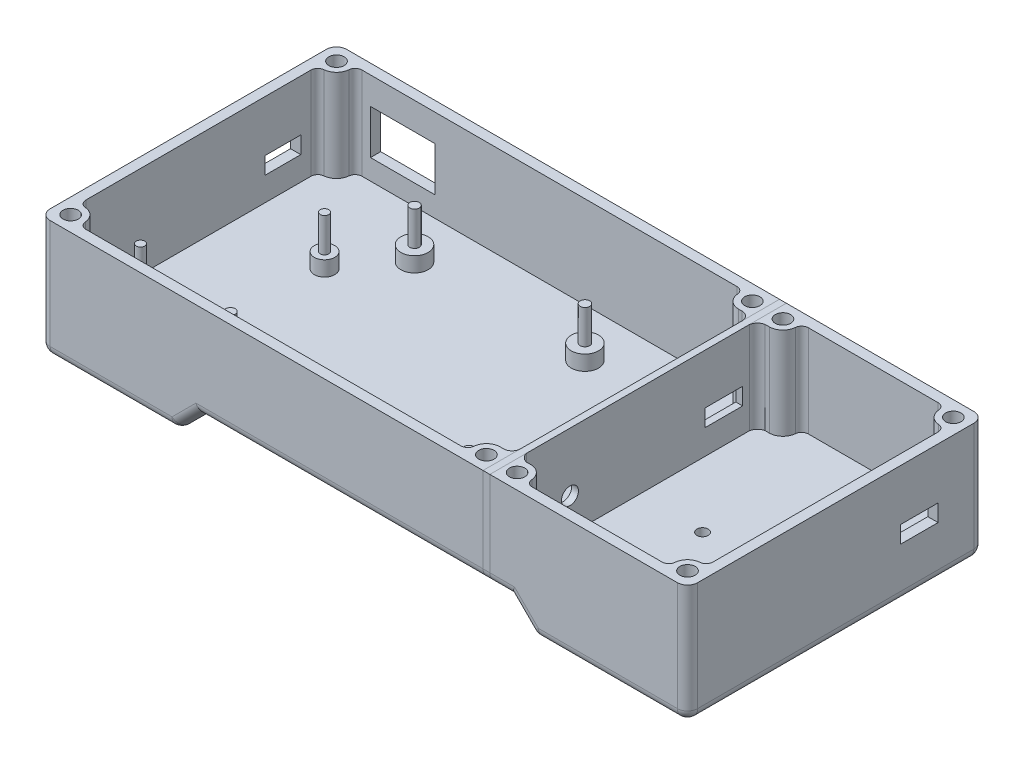
from build123d import *

# Parameters (mm, degrees)
SKETCH1_W           = 128
SKETCH1_H           = 87
BOSS_EXTRUDE1_DEPTH = 17.5
SKETCH1_4_W         = 48
SKETCH1_4_H         = 87
BOSS_EXTRUDE3_DEPTH = 17.5
SKETCH1_5_W         = 2
SKETCH1_5_H         = 87
BOSS_EXTRUDE4_DEPTH = 17.5
CUT_EXTRUDE1_DEPTH  = 27
FILLET1_R           = 2
CUT_EXTRUDE2_DEPTH  = 27
FILLET2_R           = 2
SKETCH11_R          = 4
SKETCH11_R_2        = 3.5
SKETCH11_R_3        = 3
BOSS_EXTRUDE5_DEPTH = 4.4
SKETCH17_R          = 2.5
SKETCH17_W          = 11
SKETCH17_H          = 5
CUT_EXTRUDE4_DEPTH  = 10
SKETCH25_R          = 2.25
CUT_EXTRUDE8_DEPTH  = 12
SKETCH12_R          = 1.4
SKETCH12_R_2        = 1.25
BOSS_EXTRUDE6_DEPTH = 10
SKETCH21_W          = 10.5
SKETCH21_H          = 5
CUT_EXTRUDE11_DEPTH = 182.172569668
SKETCH26_R          = 2.25
CUT_EXTRUDE12_DEPTH = 12
BOSS_EXTRUDE8_DEPTH = 2
SKETCH24_W          = 19
SKETCH24_H          = 13
CUT_EXTRUDE13_DEPTH = 126.072978696
BOSS_EXTRUDE9_DEPTH = 13
SKETCH32_W          = 19
SKETCH32_H          = 4
CUT_EXTRUDE17_DEPTH = 133.952059029
CUT_EXTRUDE18_DEPTH = 133.952059029
CUT_EXTRUDE19_DEPTH = 133.952059029
SKETCH38_W          = 2
SKETCH38_H          = 7
CUT_EXTRUDE20_DEPTH = 133.952059029
SKETCH39_W          = 33
SKETCH39_H          = 33.5
CUT_EXTRUDE21_DEPTH = 7
SKETCH40_R          = 1.65
CUT_EXTRUDE22_DEPTH = 112.45514793
CUT_EXTRUDE23_DEPTH = 3
SKETCH42_W          = 11
SKETCH42_H          = 5
CUT_EXTRUDE24_DEPTH = 193.788744485
FILLET3_R           = 3
FILLET4_R           = 3
FILLET5_R           = 3
FILLET6_R           = 3


with BuildPart() as part:
    # Sketch1 → Boss-Extrude1 (new, symmetric)
    with BuildSketch(Plane(origin=(0, 0, 0), x_dir=(1, 0, 0), z_dir=(0, 1, 0))):
        with Locations((-25, 0)):
            Rectangle(SKETCH1_W, SKETCH1_H)
    extrude(amount=BOSS_EXTRUDE1_DEPTH, both=True)

    # Sketch10 → Cut-Extrude2 (cut)
    with BuildSketch(Plane(origin=(0, 17.5, 0), x_dir=(1, 0, 0), z_dir=(0, 1, 0))):
        with BuildLine():
            Line((-80.791900756, -40.5), (31.791900756, -40.5))
            ThreePointArc((31.791900756, -40.5), (32.18337521, -36.763932023), (35.5, -35))
            Line((35.5, -35), (36.5, -35))
            ThreePointArc((36.5, -35), (38.267766953, -34.267766953), (39, -32.5))
            Line((39, -32.5), (39, 32.5))
            ThreePointArc((39, 32.5), (38.267766953, 34.267766953), (36.5, 35))
            Line((36.5, 35), (35.5, 35))
            ThreePointArc((35.5, 35), (32.18337521, 36.763932023), (31.791900756, 40.5))
            Line((31.791900756, 40.5), (-80.791900756, 40.5))
            ThreePointArc((-80.791900756, 40.5), (-81.671572875, 36.171572875), (-86, 35.291900756))
            Line((-86, 35.291900756), (-86, -35.291900756))
            ThreePointArc((-86, -35.291900756), (-81.671572875, -36.171572875), (-80.791900756, -40.5))
        make_face()
    extrude(amount=-CUT_EXTRUDE2_DEPTH, mode=Mode.SUBTRACT)

    # Fillet2
    fillet2_edges = [part.edges().sort_by_distance(p)[0] for p in [
        (-86, 4, -35.291900756),
        (-80.791900756, 4, -40.5),
        (31.791900756, 4, -40.5),
        (31.791900756, 4, 40.5),
        (-80.791900756, 4, 40.5),
        (-86, 4, 35.291900756),
    ]]
    fillet(fillet2_edges, radius=FILLET2_R)

    # Sketch11 → Boss-Extrude5 (add)
    with BuildSketch(Plane(origin=(0, -9.5, 0), x_dir=(1, 0, 0), z_dir=(0, 1, 0))):
        with Locations(Location((-51.05, 26.45, 0), (0, 0, 270))):
            Circle(SKETCH11_R)
        with Locations(Location((-1.05, 26.45, 0), (0, 0, 270))):
            Circle(SKETCH11_R)
        with Locations(Location((-51.05, -27.55, 0), (0, 0, 270))):
            Circle(SKETCH11_R)
        with Locations(Location((18.95, -27.55, 0), (0, 0, 270))):
            Circle(SKETCH11_R_2)
        with Locations(Location((-62.5, 11.5, 0), (0, 0, 270))):
            Circle(SKETCH11_R_3)
        with Locations(Location((-79.5, -23.5, 0), (0, 0, 270))):
            Circle(SKETCH11_R_3)
    extrude(amount=BOSS_EXTRUDE5_DEPTH)

    # Sketch12 → Boss-Extrude6 (add)
    with BuildSketch(Plane(origin=(0, -5.1, 0), x_dir=(1, 0, 0), z_dir=(0, 1, 0))):
        with Locations(Location((-51.05, 26.45, 0), (0, 0, 270))):
            Circle(SKETCH12_R)
        with Locations(Location((-1.05, 26.45, 0), (0, 0, 270))):
            Circle(SKETCH12_R)
        with Locations(Location((18.95, -27.55, 0), (0, 0, 270))):
            Circle(SKETCH12_R)
        with Locations(Location((-51.05, -27.55, 0), (0, 0, 270))):
            Circle(SKETCH12_R)
        with Locations(Location((-62.5, 11.5, 0), (0, 0, 270))):
            Circle(SKETCH12_R_2)
        with Locations(Location((-79.5, -23.5, 0), (0, 0, 270))):
            Circle(SKETCH12_R_2)
    extrude(amount=BOSS_EXTRUDE6_DEPTH)

    # Sketch21 → Cut-Extrude11 (cut, through all)
    with BuildSketch(Plane(origin=(-86, 0, 0), x_dir=(0, 0, -1), z_dir=(1, 0, 0))):
        with Locations((24.770869628, 0)):
            Rectangle(SKETCH21_W, SKETCH21_H)
    extrude(amount=-CUT_EXTRUDE11_DEPTH, mode=Mode.SUBTRACT)

    # Sketch26 → Cut-Extrude12 (cut)
    with BuildSketch(Plane(origin=(0, 17.5, 0), x_dir=(1, 0, 0), z_dir=(0, 1, 0))):
        with Locations(Location((35.5, -39, 0), (0, 0, 270))):
            Circle(SKETCH26_R)
        with Locations(Location((-84.5, -39, 0), (0, 0, 270))):
            Circle(SKETCH26_R)
        with Locations(Location((-84.5, 39, 0), (0, 0, 270))):
            Circle(SKETCH26_R)
        with Locations(Location((35.5, 39, 0), (0, 0, 270))):
            Circle(SKETCH26_R)
    extrude(amount=-CUT_EXTRUDE12_DEPTH, mode=Mode.SUBTRACT)


with BuildPart() as body_2:
    # Sketch1<4> → Boss-Extrude3 (new, symmetric)
    with BuildSketch(Plane(origin=(0, 0, 0), x_dir=(1, 0, 0), z_dir=(0, 1, 0))):
        with Locations((65, 0)):
            Rectangle(SKETCH1_4_W, SKETCH1_4_H)
    extrude(amount=BOSS_EXTRUDE3_DEPTH, both=True)

    # Sketch8 → Cut-Extrude1 (cut)
    with BuildSketch(Plane(origin=(0, 17.5, 0), x_dir=(1, 0, 0), z_dir=(0, 1, 0))):
        with BuildLine():
            Line((48.208099244, -40.5), (80.791900756, -40.5))
            ThreePointArc((80.791900756, -40.5), (81.671572875, -36.171572875), (86, -35.291900756))
            Line((86, -35.291900756), (86, 35.291900756))
            ThreePointArc((86, 35.291900756), (81.671572875, 36.171572875), (80.791900756, 40.5))
            Line((80.791900756, 40.5), (48.208099244, 40.5))
            ThreePointArc((48.208099244, 40.5), (47.825202325, 36.776707509), (44.530775495, 35.000118393))
            Line((44.530775495, 35.000118393), (43.253180936, 35.000118393))
            ThreePointArc((43.253180936, 35.000118393), (41.772790705, 34.18175539), (41, 32.677073441))
            Line((41, 32.677073441), (41, -32.677073441))
            ThreePointArc((41, -32.677073441), (41.772790705, -34.18175539), (43.253180936, -35.000118393))
            Line((43.253180936, -35.000118393), (44.530775495, -35.000118393))
            ThreePointArc((44.530775495, -35.000118393), (47.825202325, -36.776707509), (48.208099244, -40.5))
        make_face()
    extrude(amount=-CUT_EXTRUDE1_DEPTH, mode=Mode.SUBTRACT)

    # Fillet1
    fillet1_edges = [body_2.edges().sort_by_distance(p)[0] for p in [
        (80.791900756, 4, -40.5),
        (86, 4, -35.291900756),
        (86, 4, 35.291900756),
        (80.791900756, 4, 40.5),
        (48.208099244, 4, 40.5),
        (48.208099244, 4, -40.5),
    ]]
    fillet(fillet1_edges, radius=FILLET1_R)

    # Sketch25 → Cut-Extrude8 (cut)
    with BuildSketch(Plane(origin=(0, 17.5, 0), x_dir=(1, 0, 0), z_dir=(0, 1, 0))):
        with Locations(Location((44.5, 39, 0), (0, 0, 270))):
            Circle(SKETCH25_R)
        with Locations(Location((84.5, 39, 0), (0, 0, 270))):
            Circle(SKETCH25_R)
        with Locations(Location((84.5, -39, 0), (0, 0, 270))):
            Circle(SKETCH25_R)
        with Locations(Location((44.5, -39, 0), (0, 0, 270))):
            Circle(SKETCH25_R)
    extrude(amount=-CUT_EXTRUDE8_DEPTH, mode=Mode.SUBTRACT)


with BuildPart() as body_3:
    # Sketch1<5> → Boss-Extrude4 (new, symmetric)
    with BuildSketch(Plane(origin=(0, 0, 0), x_dir=(1, 0, 0), z_dir=(0, 1, 0))):
        with Locations((40, 0)):
            Rectangle(SKETCH1_5_W, SKETCH1_5_H)
    extrude(amount=BOSS_EXTRUDE4_DEPTH, both=True)

    # Sketch17 → Cut-Extrude4 (cut)
    with BuildSketch(Plane(origin=(41, 0, 0), x_dir=(0, 0, -1), z_dir=(1, 0, 0))):
        with Locations((-20, 0.308666976)):
            Circle(SKETCH17_R)
        with Locations((25.177073441, 0.308666976)):
            Rectangle(SKETCH17_W, SKETCH17_H)
    extrude(amount=-CUT_EXTRUDE4_DEPTH, mode=Mode.SUBTRACT)

    # Sketch38 → Cut-Extrude20 (cut, through all)
    with BuildSketch(Plane(origin=(0, 0, -43.5), x_dir=(-1, 0, 0), z_dir=(0, 0, -1))):
        with Locations((-40, -14)):
            Rectangle(SKETCH38_W, SKETCH38_H)
    extrude(amount=-CUT_EXTRUDE20_DEPTH, mode=Mode.SUBTRACT)

    # Fillet4
    fillet4_edges = [body_3.edges().sort_by_distance(p)[0] for p in [
        (40, -10.5, 43.5),
        (40, -10.5, -43.5),
    ]]
    fillet(fillet4_edges, radius=FILLET4_R)


with BuildPart() as body_4:
    # Split2: the piece on the far side of the plane
    add(part.part)
    split(bisect_by=Plane(origin=(-75, 0, 0), x_dir=(0, 0, -1), z_dir=(-1, 0, 0)), keep=Keep.BOTTOM)


with BuildPart() as part_1:
    add(part.part)

    # Split2
    split(bisect_by=Plane(origin=(-75, 0, 0), x_dir=(0, 0, -1), z_dir=(-1, 0, 0)), keep=Keep.TOP)


with BuildPart() as part_2:
    # Body-Move/Copy3: moved
    add(part_1.part.moved(Location((-2, 0, 0))))


    add(body_4.part)  # Boss-Extrude8 merges body 4
    # Sketch29 → Boss-Extrude8 (add)
    with BuildSketch(Plane(origin=(-77, 0, 0), x_dir=(0, 0, -1), z_dir=(1, 0, 0))):
        Polygon((43.5, -17.5), (43.5, 17.5), (40.5, 17.5), (40.5, -9.5), (-40.5, -9.5), (-40.5, 17.5), (-43.5, 17.5), (-43.5, -17.5), align=None)
    extrude(amount=BOSS_EXTRUDE8_DEPTH)

    # Sketch24 → Cut-Extrude13 (cut, through all)
    with BuildSketch(Plane.XY.offset(-40.5)):
        with Locations((-68.520869628, 3)):
            Rectangle(SKETCH24_W, SKETCH24_H)
    extrude(amount=-CUT_EXTRUDE13_DEPTH, mode=Mode.SUBTRACT)

    # Sketch32 → Cut-Extrude17 (cut, through all)
    with BuildSketch(Plane(origin=(0, 0, -43.5), x_dir=(-1, 0, 0), z_dir=(0, 0, -1))):
        Polygon((-35, -10.5), (-31, -10.5), (-31, -14.5), align=None)
        with Locations((-21.5, -12.5)):
            Rectangle(SKETCH32_W, SKETCH32_H)
        Polygon((-12, -14.5), (-8, -10.5), (-12, -10.5), align=None)
        Polygon((35, -10.5), (31, -10.5), (12, -10.5), (8, -10.5), (12, -14.5), (31, -14.5), align=None)
    extrude(amount=-CUT_EXTRUDE17_DEPTH, mode=Mode.SUBTRACT)

    # Sketch36 → Cut-Extrude18 (cut, through all)
    with BuildSketch(Plane(origin=(0, 0, -43.5), x_dir=(-1, 0, 0), z_dir=(0, 0, -1))):
        Polygon((5, -10.5), (-5, -10.5), (-12, -17.5), (12, -17.5), align=None)
        Polygon((-39, -17.5), (-31, -17.5), (-38, -10.5), (-39, -10.5), align=None)
        Polygon((38, -10.5), (31, -17.5), (51, -17.5), (44, -10.5), align=None)
    extrude(amount=-CUT_EXTRUDE18_DEPTH, mode=Mode.SUBTRACT)

    # Sketch39 → Cut-Extrude21 (cut)
    with BuildSketch(Plane.XZ.offset(17.5)):
        with Locations((21.5, 26.75)):
            Rectangle(SKETCH39_W, SKETCH39_H)
        with Locations((21.5, -26.75)):
            Rectangle(SKETCH39_W, SKETCH39_H)
        with Locations((-21.5, -26.75)):
            Rectangle(SKETCH39_W, SKETCH39_H)
        with Locations((-21.5, 26.75)):
            Rectangle(SKETCH39_W, SKETCH39_H)
    extrude(amount=-CUT_EXTRUDE21_DEPTH, mode=Mode.SUBTRACT)

    # Fillet3
    fillet3_edges = [part_2.edges().sort_by_distance(p)[0] for p in [
        (-2.5, -10.5, -43.5),
        (-2.5, -10.5, 43.5),
        (-51, -17.5, 0),
        (-47.5, -14, -43.5),
        (-47.5, -14, 43.5),
        (-71, -17.5, -43.5),
        (-71, -17.5, 43.5),
        (-91, 0, -43.5),
        (-91, 0, 43.5),
        (-91, -17.5, 0),
    ]]
    fillet(fillet3_edges, radius=FILLET3_R)


with BuildPart() as body_4_2:
    # Split3: the piece on the far side of the plane
    add(body_2.part)
    split(bisect_by=Plane(origin=(65, 0, 0), x_dir=(0, 0, 1), z_dir=(1, 0, 0)), keep=Keep.BOTTOM)


with BuildPart() as body_2_1:
    add(body_2.part)

    # Split3
    split(bisect_by=Plane(origin=(65, 0, 0), x_dir=(0, 0, 1), z_dir=(1, 0, 0)), keep=Keep.TOP)


with BuildPart() as body_2_2:
    # Body-Move/Copy5: moved
    add(body_2_1.part.moved(Location((10, 0, 0))))


    add(body_4_2.part)  # Boss-Extrude9 merges body 4 2
    # Sketch31 → Boss-Extrude9 (add)
    with BuildSketch(Plane(origin=(65, 0, 0), x_dir=(0, 0, -1), z_dir=(1, 0, 0))):
        Polygon((43.5, 17.5), (40.5, 17.5), (40.5, -9.5), (-40.5, -9.5), (-40.5, 17.5), (-43.5, 17.5), (-43.5, -17.5), (43.5, -17.5), align=None)
    extrude(amount=BOSS_EXTRUDE9_DEPTH)

    # Sketch37 → Cut-Extrude19 (cut, through all)
    with BuildSketch(Plane(origin=(0, 0, -43.5), x_dir=(-1, 0, 0), z_dir=(0, 0, -1))):
        Polygon((-47, -10.5), (-54, -17.5), (-41, -17.5), (-41, -10.5), align=None)
    extrude(amount=-CUT_EXTRUDE19_DEPTH, mode=Mode.SUBTRACT)

    # Sketch40 → Cut-Extrude22 (cut, through all)
    with BuildSketch(Plane(origin=(0, -9.5, 0), x_dir=(1, 0, 0), z_dir=(0, 1, 0))):
        with Locations(Location((59.9, 0, 0), (0, 0, 270))):
            Circle(SKETCH40_R)
        with Locations(Location((79.1, 0, 0), (0, 0, 90))):
            Circle(SKETCH40_R)
    extrude(amount=-CUT_EXTRUDE22_DEPTH, mode=Mode.SUBTRACT)

    # Sketch41 → Cut-Extrude23 (cut)
    with BuildSketch(Plane.XZ.offset(17.5)):
        Polygon((59.9, 3.319764048), (57.025, 1.659882024), (57.025, -1.659882024), (59.9, -3.319764048), (62.775, -1.659882024), (62.775, 1.659882024), align=None)
        Polygon((79.1, 3.319764048), (76.225, 1.659882024), (76.225, -1.659882024), (79.1, -3.319764048), (81.975, -1.659882024), (81.975, 1.659882024), align=None)
    extrude(amount=-CUT_EXTRUDE23_DEPTH, mode=Mode.SUBTRACT)

    # Sketch42 → Cut-Extrude24 (cut, through all)
    with BuildSketch(Plane.ZY.offset(-96)):
        with Locations((-24.520869628, 0)):
            Rectangle(SKETCH42_W, SKETCH42_H)
    extrude(amount=-CUT_EXTRUDE24_DEPTH, mode=Mode.SUBTRACT)

    # Fillet5
    fillet5_edges = [body_2_2.edges().sort_by_distance(p)[0] for p in [
        (76.5, -17.5, -43.5),
        (50.5, -14, -43.5),
        (54, -17.5, 0),
        (44, -10.5, -43.5),
        (50.5, -14, 43.5),
        (44, -10.5, 43.5),
        (99, -17.5, 0),
        (76.5, -17.5, 43.5),
    ]]
    fillet(fillet5_edges, radius=FILLET5_R)

    # Fillet6
    # the kernel refuses this fillet: 3 mm, written as the material it takes off along each edge
    with BuildSketch(Plane(origin=(96, -14.5, 40.5), x_dir=(1, 0, 0), z_dir=(0, 0, 1))) as fillet6_piece_1_section:
        Polygon((0, 0), (FILLET6_R, 0), (FILLET6_R, -FILLET6_R), (0, -FILLET6_R), align=None)
    fillet6_piece_1 = extrude(amount=FILLET6_R, mode=Mode.PRIVATE)
    fillet6_piece_1 = fillet6_piece_1 - Plane(origin=(96, -14.5, 40.5), x_dir=(-0.7071067811865475, 0.7071067811865475, 0), z_dir=(0, 0, 1)) * Sphere(FILLET6_R, mode=Mode.PRIVATE)
    add(fillet6_piece_1, mode=Mode.SUBTRACT)
    with BuildSketch(Plane(origin=(96, -14.5, -40.5), x_dir=(1, 0, 0), z_dir=(0, 0, -1))) as fillet6_piece_2_section:
        Polygon((0, 0), (FILLET6_R, 0), (FILLET6_R, FILLET6_R), (0, FILLET6_R), align=None)
    fillet6_piece_2 = extrude(amount=FILLET6_R, mode=Mode.PRIVATE)
    fillet6_piece_2 = fillet6_piece_2 - Plane(origin=(96, -14.5, -40.5), x_dir=(-0.7071067811865475, 0.7071067811865475, 0), z_dir=(0, 0, -1)) * Sphere(FILLET6_R, mode=Mode.PRIVATE)
    add(fillet6_piece_2, mode=Mode.SUBTRACT)
    with BuildSketch(Plane(origin=(99, -14.5, -43.5), x_dir=(-1, 0, 0), z_dir=(0, 1, 0))) as fillet6_piece_3:
        with BuildLine():
            CenterArc((FILLET6_R, FILLET6_R), FILLET6_R, 180, 90)
            Line((0, FILLET6_R), (0, 0))
            Line((0, 0), (FILLET6_R, 0))
        make_face()
    extrude(amount=39.5, mode=Mode.SUBTRACT)
    with BuildSketch(Plane(origin=(99, -14.5, 43.5), x_dir=(-1, 0, 0), z_dir=(0, 1, 0))) as fillet6_piece_4:
        with BuildLine():
            CenterArc((FILLET6_R, -FILLET6_R), FILLET6_R, 90, 90)
            Line((0, -FILLET6_R), (0, 0))
            Line((0, 0), (FILLET6_R, 0))
        make_face()
    extrude(amount=39.5, mode=Mode.SUBTRACT)


solid = Compound([body_3.part, part_2.part, body_2_2.part])
